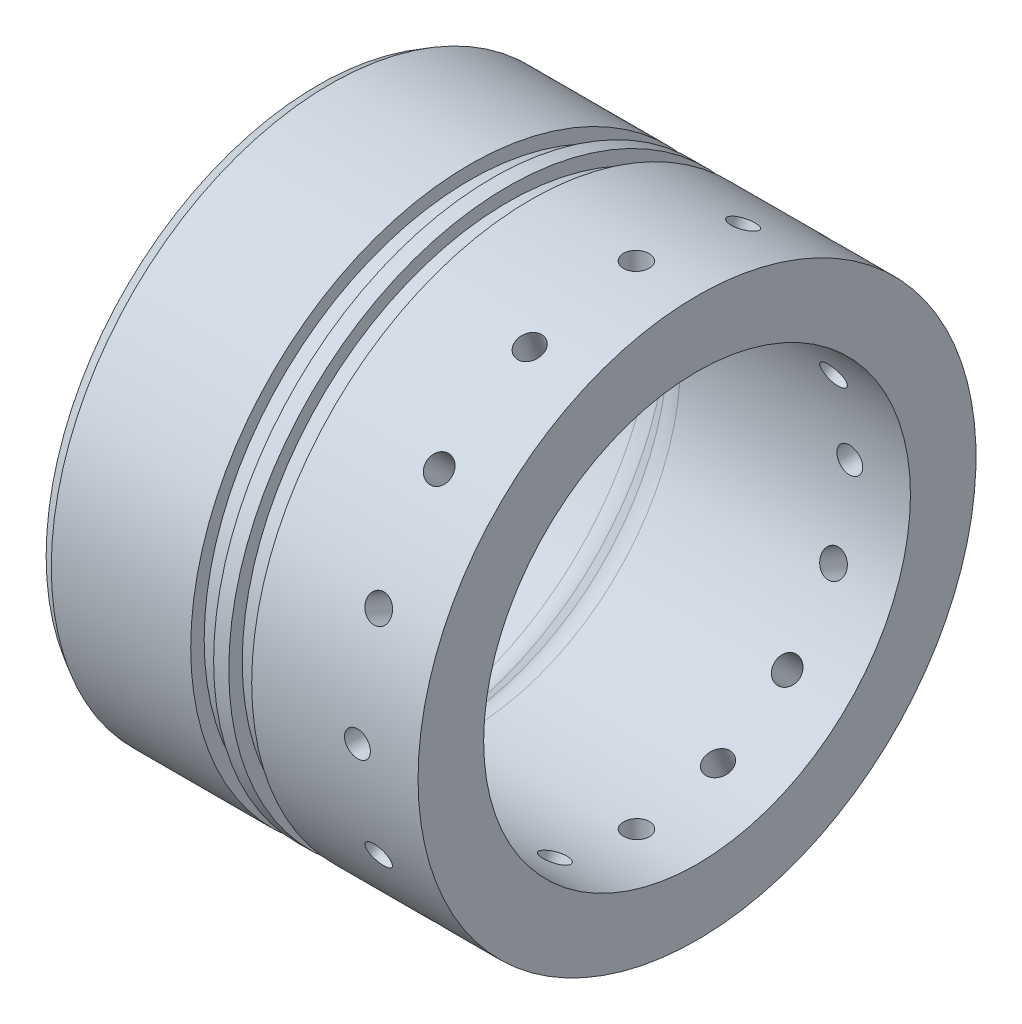
from build123d import *

# Parameters (mm, degrees)
TAP_DRILL_FOR_1_4_28_TAP1_D = 5.4102
TAP_PATTERN_COUNT           = 16
CHAMFER1_SIZE               = 2.54
CHAMFER1_SIZE2              = 1.466469684


with BuildPart() as part:
    # Sketch1 → Revolve1 (revolve)
    with BuildSketch(Plane.XY):
        with BuildLine():
            Line((-8.480193932, 4.2164), (-24.899937811, 4.2164))
            Line((-24.899937811, 4.2164), (-24.899937811, 0))
            Line((-24.899937811, 0), (6.850062189, 0))
            Line((6.850062189, 0), (6.850062189, 2.8194))
            Line((6.850062189, 2.8194), (11.650662189, 2.8194))
            Line((11.650662189, 2.8194), (11.650662189, 0))
            Line((11.650662189, 0), (14.825662189, 0))
            Line((14.825662189, 0), (14.825662189, 2.8194))
            Line((14.825662189, 2.8194), (19.626262189, 2.8194))
            Line((19.626262189, 2.8194), (19.626262189, 0))
            Line((19.626262189, 0), (54.475062189, 0))
            Line((54.475062189, 0), (54.475062189, 13.7414))
            Line((54.475062189, 13.7414), (6.30531831, 13.7414))
            ThreePointArc((6.30531831, 13.7414), (3.875278514, 13.258035031), (1.815190249, 11.881528061))
            Line((1.815190249, 11.881528061), (-3.990065872, 6.076271939))
            ThreePointArc((-3.990065872, 6.076271939), (-6.050154137, 4.699764969), (-8.480193932, 4.2164))
        make_face()
    revolve(axis=Axis((0, 58.4454, 0), (1, 0, 0)))

    # Tap Drill for 1/4-28 Tap1 (through all)
    with Locations(Plane(origin=(0, 0, -58.4454), x_dir=(-1, 0, 0), z_dir=(0, 0, -1))):
        with Locations((-41.775062189, 58.4454)):
            tap_drill_for_1_4_28_tap1 = Hole(TAP_DRILL_FOR_1_4_28_TAP1_D / 2)

    # Tap Pattern: Tap Drill for 1/4-28 Tap1 ×16 about axis
    tap_pattern_axis = Axis((0, 58.4454, 0), (1, 0, 0))
    for i in range(1, TAP_PATTERN_COUNT):
        add(tap_drill_for_1_4_28_tap1.rotate(tap_pattern_axis, i * 360 / TAP_PATTERN_COUNT), mode=Mode.SUBTRACT)

    # Chamfer1
    chamfer1_edges = [part.edges().sort_by_distance(p)[0] for p in [
        (-24.899937811, 116.8908, 0),
    ]]
    chamfer1_side = [part.faces().sort_by_distance(p)[0] for p in [
        (-9.024937811, 116.8908, 0),
    ]]
    chamfer(chamfer1_edges, length=CHAMFER1_SIZE, length2=CHAMFER1_SIZE2, reference=chamfer1_side[0])


solid = part.part
